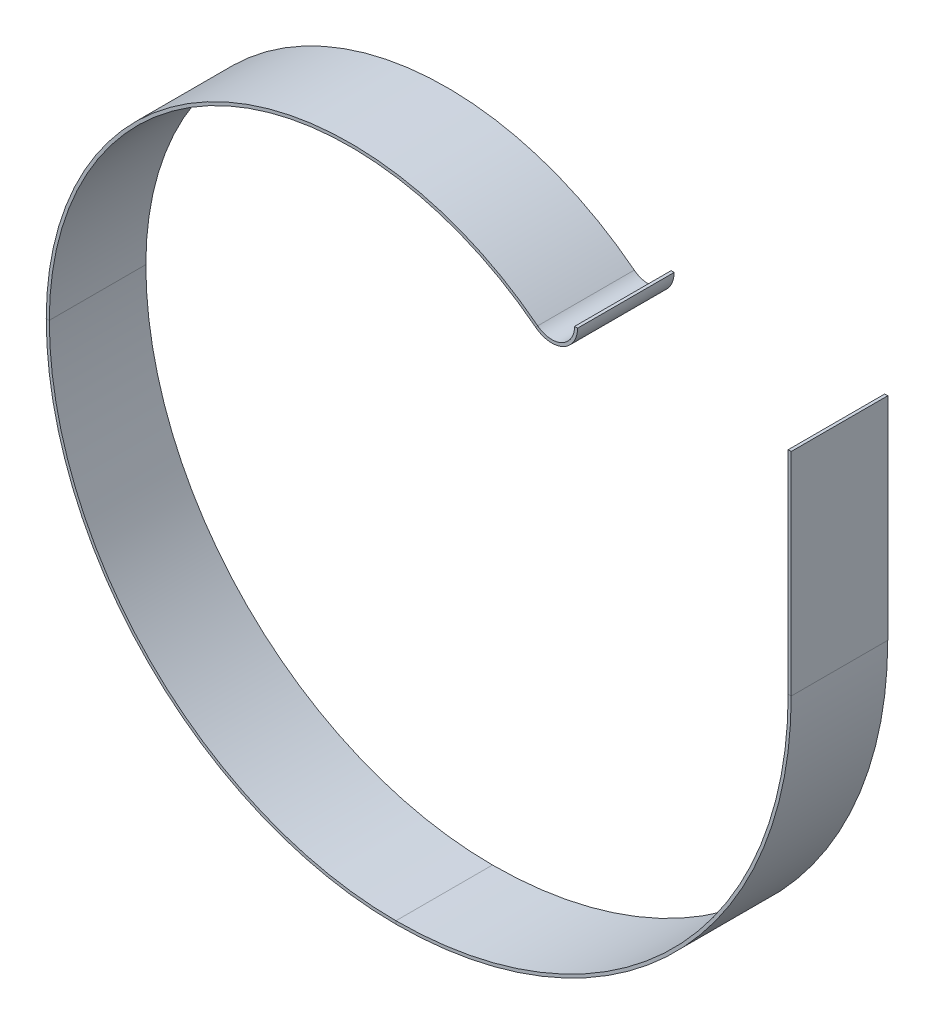
from build123d import *

# Parameters (mm, degrees)
BASE_FLANGE1_DEPTH = 63.5


# Sheet-metal steps are written as plain solids
with BuildPart() as part:
    # Sketch1 → Base-Flange1 (new, symmetric)
    with BuildSketch(Plane.XY):
        with BuildLine():
            ThreePointArc((265, 308.636973764), (248.140563862, 281.667999342), (216.511627907, 285.011138385))
            ThreePointArc((216.511627907, 285.011138385), (-205.207518157, 329.586325632), (-430, -30))
            ThreePointArc((-430, -30), (-295.269119346, -355.269119346), (30, -490))
            ThreePointArc((30, -490), (397.695526217, -337.695526217), (550, 30))
            Line((550, 30), (550, 308.636973764))
            Line((550, 308.636973764), (546, 308.636973764))
            Line((546, 308.636973764), (546, 30))
            ThreePointArc((546, 30), (394.867099092, -334.867099092), (30, -486))
            ThreePointArc((30, -486), (-292.440692221, -352.440692221), (-426, -30))
            ThreePointArc((-426, -30), (-203.455442975, 325.990462376), (214.046511628, 281.861027001))
            ThreePointArc((214.046511628, 281.861027001), (249.892639043, 278.072136085), (269, 308.636973764))
            Line((269, 308.636973764), (265, 308.636973764))
        make_face()
    extrude(amount=BASE_FLANGE1_DEPTH, both=True)


solid = part.part
